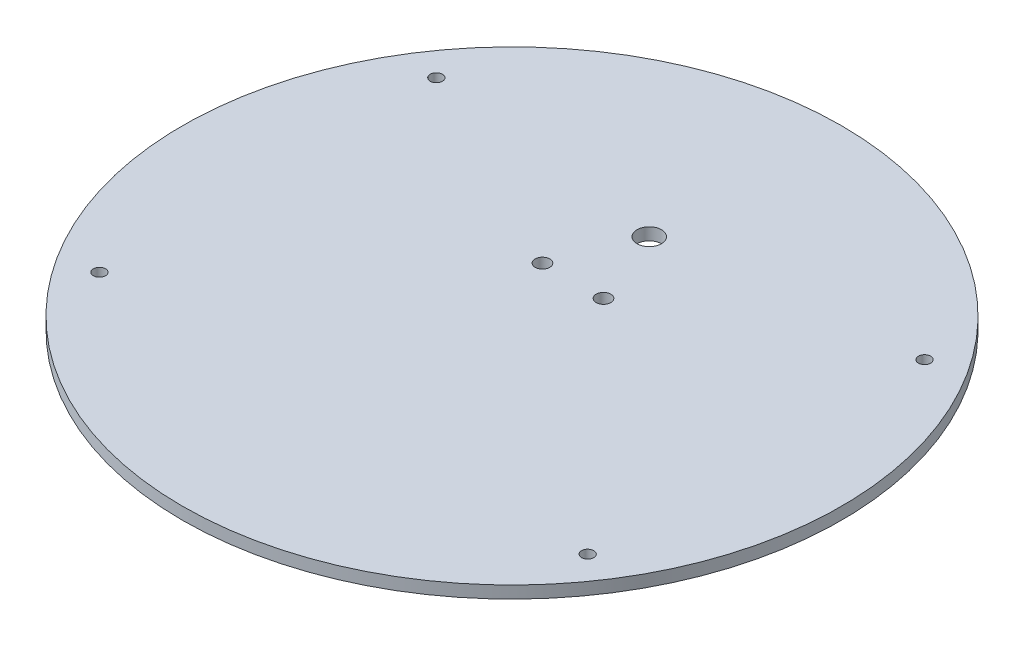
from build123d import *

# Parameters (mm, degrees)
SKETCH1_R           = 85.725
BOSS_EXTRUDE1_DEPTH = 3.175
CUT_EXTRUDE1_REACH  = 123.275
SKETCH2_R           = 1.5875
CUT_EXTRUDE2_REACH  = 123.275
SKETCH3_R           = 3.175
CUT_EXTRUDE3_REACH  = 123.275
SKETCH4_R           = 1.905


with BuildPart() as part:
    # Sketch1 → Boss-Extrude1 (new body)
    with BuildSketch(Plane(origin=(0, 0, 0), x_dir=(1, 0, 0), z_dir=(0, 1, 0))):
        Circle(SKETCH1_R)
    extrude(amount=BOSS_EXTRUDE1_DEPTH)

    # Sketch2 → Cut-Extrude1 (cut, up to next)
    with BuildSketch(Plane(origin=(0, 3.175, 0), x_dir=(1, 0, 0), z_dir=(0, 1, 0)), mode=Mode.PRIVATE) as cut_extrude1_sk1:
        with Locations((-63.5, 43.815)):
            Circle(SKETCH2_R)
    cut_extrude1_tool1 = extrude(cut_extrude1_sk1.sketch, amount=-CUT_EXTRUDE1_REACH, mode=Mode.PRIVATE) & part.part
    # Sketch2 → Cut-Extrude1 (cut, up to next)
    with BuildSketch(Plane(origin=(0, 3.175, 0), x_dir=(1, 0, 0), z_dir=(0, 1, 0)), mode=Mode.PRIVATE) as cut_extrude1_sk2:
        with Locations((63.5, 43.815)):
            Circle(SKETCH2_R)
    cut_extrude1_tool2 = extrude(cut_extrude1_sk2.sketch, amount=-CUT_EXTRUDE1_REACH, mode=Mode.PRIVATE) & part.part
    # Sketch2 → Cut-Extrude1 (cut, up to next)
    with BuildSketch(Plane(origin=(0, 3.175, 0), x_dir=(1, 0, 0), z_dir=(0, 1, 0)), mode=Mode.PRIVATE) as cut_extrude1_sk3:
        with Locations((-63.5, -43.815)):
            Circle(SKETCH2_R)
    cut_extrude1_tool3 = extrude(cut_extrude1_sk3.sketch, amount=-CUT_EXTRUDE1_REACH, mode=Mode.PRIVATE) & part.part
    # Sketch2 → Cut-Extrude1 (cut, up to next)
    with BuildSketch(Plane(origin=(0, 3.175, 0), x_dir=(1, 0, 0), z_dir=(0, 1, 0)), mode=Mode.PRIVATE) as cut_extrude1_sk4:
        with Locations((63.5, -43.815)):
            Circle(SKETCH2_R)
    cut_extrude1_tool4 = extrude(cut_extrude1_sk4.sketch, amount=-CUT_EXTRUDE1_REACH, mode=Mode.PRIVATE) & part.part
    add(cut_extrude1_tool1.solids().sort_by_distance((-63.5, 3.175, -43.815))[0], mode=Mode.SUBTRACT)
    add(cut_extrude1_tool2.solids().sort_by_distance((63.5, 3.175, -43.815))[0], mode=Mode.SUBTRACT)
    add(cut_extrude1_tool3.solids().sort_by_distance((-63.5, 3.175, 43.815))[0], mode=Mode.SUBTRACT)
    add(cut_extrude1_tool4.solids().sort_by_distance((63.5, 3.175, 43.815))[0], mode=Mode.SUBTRACT)

    # Sketch3 → Cut-Extrude2 (cut, up to next)
    with BuildSketch(Plane(origin=(0, 3.175, 0), x_dir=(1, 0, 0), z_dir=(0, 1, 0)), mode=Mode.PRIVATE) as cut_extrude2_sk1:
        with Locations((0, 35.70224)):
            Circle(SKETCH3_R)
    cut_extrude2_tool1 = extrude(cut_extrude2_sk1.sketch, amount=-CUT_EXTRUDE2_REACH, mode=Mode.PRIVATE) & part.part
    add(cut_extrude2_tool1.solids().sort_by_distance((0, 3.175, -35.70224))[0], mode=Mode.SUBTRACT)

    # Sketch4 → Cut-Extrude3 (cut, up to next)
    with BuildSketch(Plane.XZ, mode=Mode.PRIVATE) as cut_extrude3_sk1:
        with Locations((-7.9375, -15.85849)):
            Circle(SKETCH4_R)
    cut_extrude3_tool1 = extrude(cut_extrude3_sk1.sketch, amount=-CUT_EXTRUDE3_REACH, mode=Mode.PRIVATE) & part.part
    # Sketch4 → Cut-Extrude3 (cut, up to next)
    with BuildSketch(Plane.XZ, mode=Mode.PRIVATE) as cut_extrude3_sk2:
        with Locations((7.9375, -15.85849)):
            Circle(SKETCH4_R)
    cut_extrude3_tool2 = extrude(cut_extrude3_sk2.sketch, amount=-CUT_EXTRUDE3_REACH, mode=Mode.PRIVATE) & part.part
    add(cut_extrude3_tool1.solids().sort_by_distance((-7.9375, 0, -15.85849))[0], mode=Mode.SUBTRACT)
    add(cut_extrude3_tool2.solids().sort_by_distance((7.9375, 0, -15.85849))[0], mode=Mode.SUBTRACT)


solid = part.part
